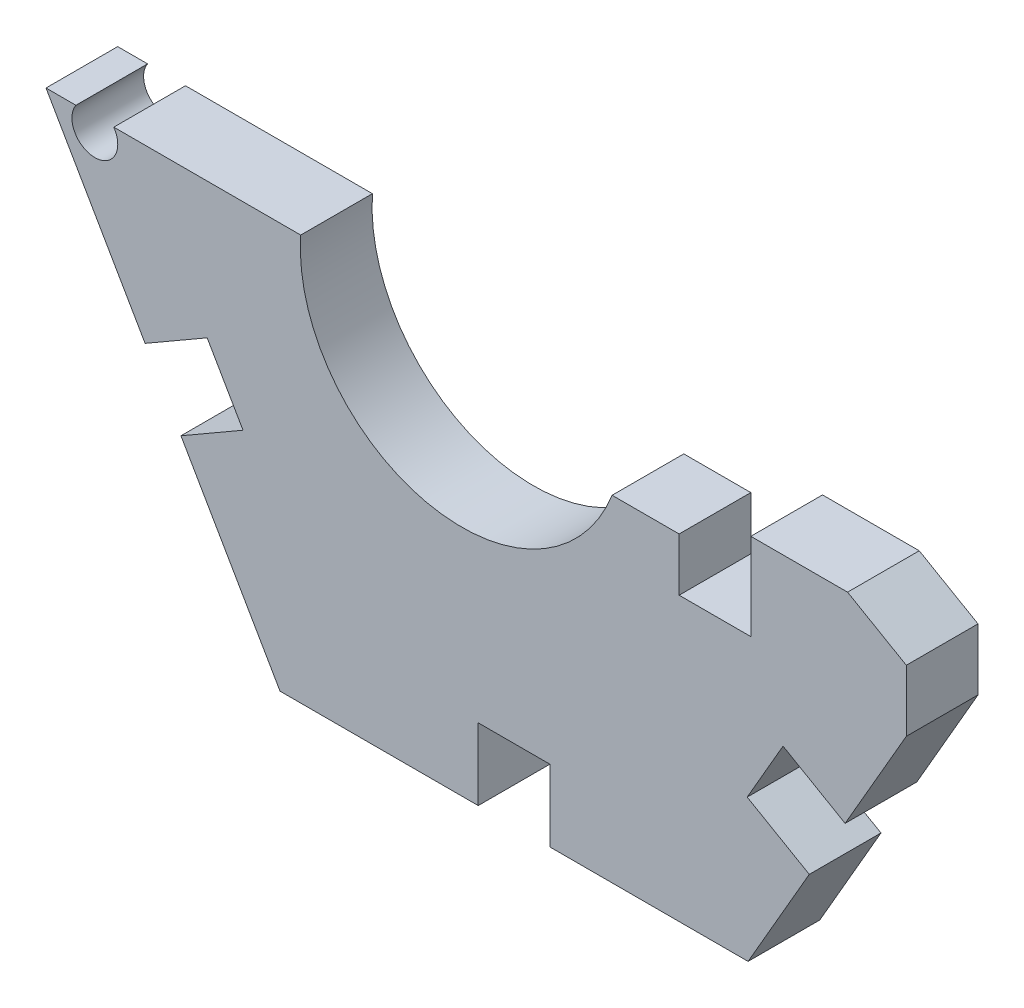
from build123d import *

# Parameters (mm, degrees)
BOSS_EXTRUDE1_DEPTH = 1.524


with BuildPart() as part:
    # Sketch1 → Boss-Extrude1 (new body)
    with BuildSketch(Plane.XY):
        with BuildLine():
            Line((-1.524, -3.370487407), (-1.524, -2.242816697))
            Line((-1.524, -2.242816697), (-2.948940421, -2.242816697))
            ThreePointArc((-2.948940421, -2.242816697), (-6.894908595, -4.346494089), (-9.568394246, -0.762))
            Line((-9.568394246, -0.762), (-13.542451242, -0.762))
            ThreePointArc((-13.542451242, -0.762), (-13.945094124, -1.524), (-14.347737007, -0.762))
            Line((-14.347737007, -0.762), (-14.983528559, -0.762))
            Line((-14.983528559, -0.762), (-12.876931855, -4.410732522))
            Line((-12.876931855, -4.410732522), (-11.557109139, -3.648732522))
            Line((-11.557109139, -3.648732522), (-10.795109139, -4.968555238))
            Line((-10.795109139, -4.968555238), (-12.114931855, -5.730555238))
            Line((-12.114931855, -5.730555238), (-10.008335151, -9.37928776))
            Line((-10.008335151, -9.37928776), (-5.795141743, -9.37928776))
            Line((-5.795141743, -9.37928776), (-5.795141743, -7.85528776))
            Line((-5.795141743, -7.85528776), (-4.271141743, -7.85528776))
            Line((-4.271141743, -7.85528776), (-4.271141743, -9.37928776))
            Line((-4.271141743, -9.37928776), (-0.057948335, -9.37928776))
            Line((-0.057948335, -9.37928776), (1.242798406, -7.126328317))
            Line((1.242798406, -7.126328317), (-0.077024309, -6.364328317))
            Line((-0.077024309, -6.364328317), (0.684975691, -5.044505601))
            Line((0.684975691, -5.044505601), (2.004798406, -5.806505601))
            Line((2.004798406, -5.806505601), (3.305545147, -3.553546158))
            Line((3.305545147, -3.553546158), (3.305545147, -2.245084323))
            Line((3.305545147, -2.245084323), (2.056590462, -1.524))
            Line((2.056590462, -1.524), (0, -1.524))
            Line((0, -1.524), (0, -3.370487407))
            Line((0, -3.370487407), (-1.524, -3.370487407))
        make_face()
    extrude(amount=BOSS_EXTRUDE1_DEPTH)


solid = part.part
